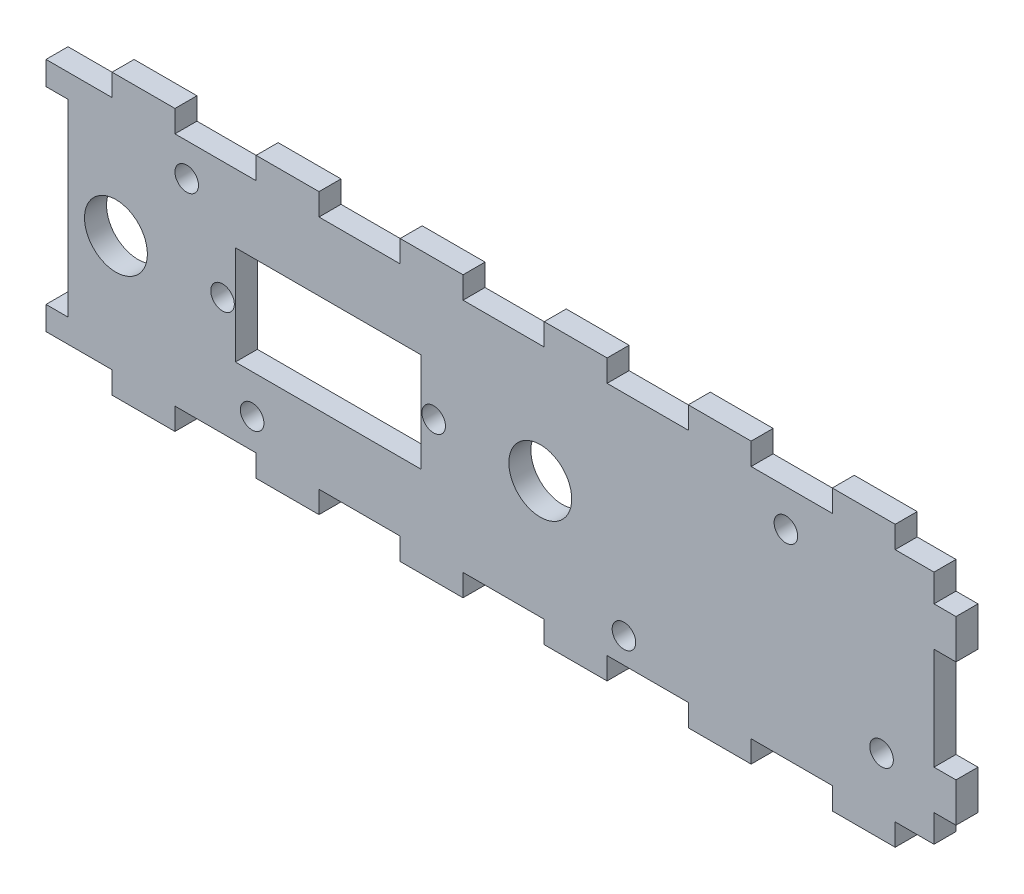
from build123d import *

# Parameters (mm, degrees)
SKETCH_1_R               = 4
EXTRUDE_1_DEPTH          = 1.4
CUT_EXTRUDE_1_DEPTH      = 61.639013844
CUT_EXTRUDE_1_DEPTH_BACK = 61.639013844
SKETCH_2_W               = 23.6
SKETCH_2_H               = 12.6
SKETCH_2_R               = 1.5
CUT_EXTRUDE_2_DEPTH      = 61.639013844
CUT_EXTRUDE_2_DEPTH_BACK = 61.639013844
SKETCH_3_R               = 1.5
SKETCH_3_R_2             = 1.499999999
SKETCH_3_R_3             = 1.500000004


with BuildPart() as part:
    # Эскиз1 → Бобышка-Вытянуть1 (new, symmetric)
    with BuildSketch(Plane.XY):
        Polygon((-55.1, 15), (-49.49, 15), (-49.49, 17.8), (-41.49, 17.8), (-41.49, 15), (-31.16, 15), (-31.16, 17.8), (-23.16, 17.8), (-23.16, 15), (-12.83, 15), (-12.83, 17.8), (-4.83, 17.8), (-4.83, 15), (5.5, 15), (5.5, 17.8), (13.5, 17.8), (13.5, 15), (23.83, 15), (23.83, 17.8), (31.83, 17.8), (31.83, 15), (42.16, 15), (42.16, 17.8), (50.16, 17.8), (50.16, 15), (55.1, 15), (55.1, 11.5), (57.9, 11.5), (57.9, 6.5), (55.1, 6.5), (55.1, 5), (55.1, -5), (55.1, -6.5), (57.9, -6.5), (57.9, -11.5), (55.1, -11.5), (55.1, -15), (50.16, -15), (50.16, -17.8), (42.16, -17.8), (42.16, -15), (31.83, -15), (31.83, -17.8), (23.83, -17.8), (23.83, -15), (13.5, -15), (13.5, -17.8), (5.5, -17.8), (5.5, -15), (-4.83, -15), (-4.83, -17.8), (-12.83, -17.8), (-12.83, -15), (-23.16, -15), (-23.16, -17.8), (-31.16, -17.8), (-31.16, -15), (-41.49, -15), (-41.49, -17.8), (-49.49, -17.8), (-49.49, -15), (-55.1, -15), (-57.9, -15), (-57.9, -12), (-55.1, -12), (-55.1, -11.5), (-55.1, -6.5), (-55.1, -5), (-55.1, 5), (-55.1, 6.5), (-55.1, 11.5), (-55.1, 12), (-57.9, 12), (-57.9, 15), align=None)
        with Locations((5, 0)):
            Circle(SKETCH_1_R, mode=Mode.SUBTRACT)
        with Locations((-49, 0)):
            Circle(SKETCH_1_R, mode=Mode.SUBTRACT)
    extrude(amount=EXTRUDE_1_DEPTH, both=True)

    # Эскиз2 → Вырез-Вытянуть1 (cut, two sides: drawn at the far end of the back side and taken through both)
    with BuildSketch(Plane(origin=(0, 0, -1.4), x_dir=(-1, 0, 0), z_dir=(0, 0, -1)).offset(-CUT_EXTRUDE_1_DEPTH_BACK)):
        with Locations((22, 0)):
            Rectangle(SKETCH_2_W, SKETCH_2_H)
        with Locations((35.435, 0)):
            Circle(SKETCH_2_R)
        with Locations((8.565, 0)):
            Circle(SKETCH_2_R)
    extrude(amount=CUT_EXTRUDE_1_DEPTH + CUT_EXTRUDE_1_DEPTH_BACK, mode=Mode.SUBTRACT)

    # Эскиз3 → Вырез-Вытянуть2 (cut, two sides: drawn at the far end of the back side and taken through both)
    with BuildSketch(Plane(origin=(0, 0, -1.4), x_dir=(-1, 0, 0), z_dir=(0, 0, -1)).offset(-CUT_EXTRUDE_2_DEPTH_BACK)):
        with Locations((31.667851618, -11.228512478)):
            Circle(SKETCH_3_R)
        with Locations((-48.429379636, -8.299999991)):
            Circle(SKETCH_3_R_2)
        with Locations((-15.648202479, -11.743667469)):
            Circle(SKETCH_3_R_2)
        with Locations((39.99236744, 10.8145639)):
            Circle(SKETCH_3_R)
        with Locations((-36.253127984, 10.284376689)):
            Circle(SKETCH_3_R_3)
    extrude(amount=CUT_EXTRUDE_2_DEPTH + CUT_EXTRUDE_2_DEPTH_BACK, mode=Mode.SUBTRACT)


solid = part.part
